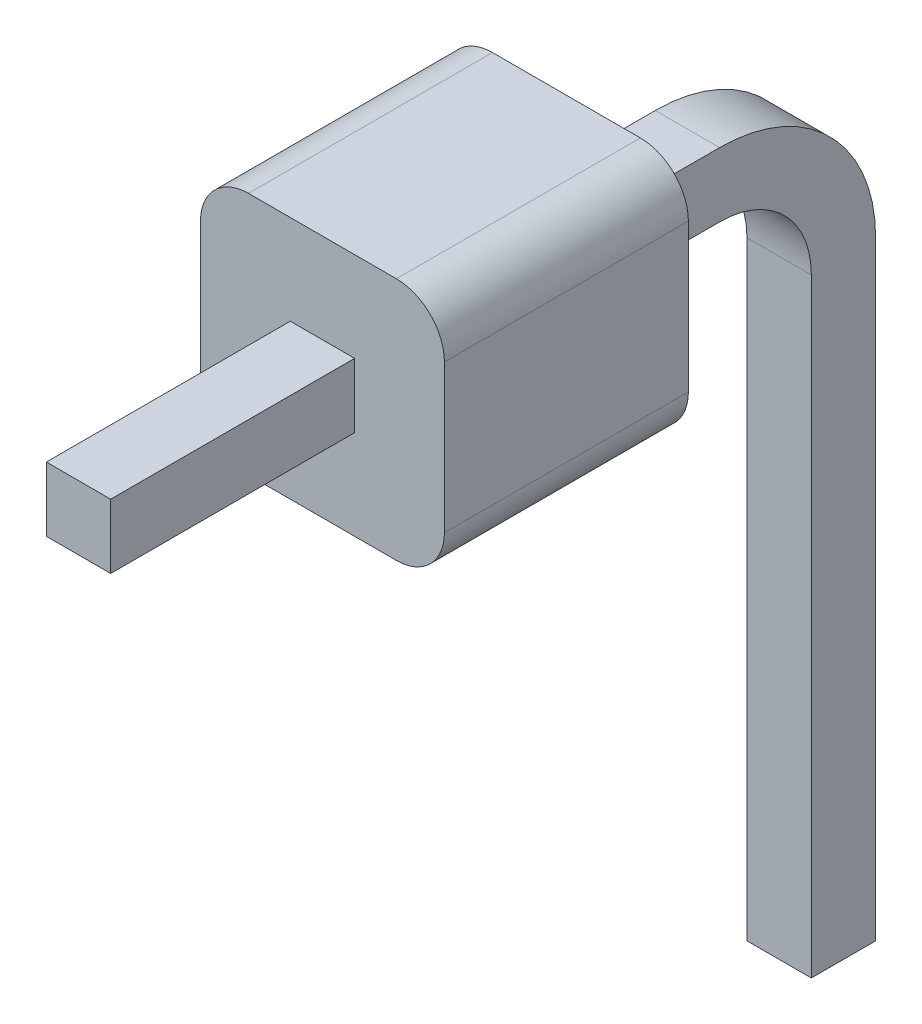
from build123d import *

# Parameters (mm, degrees)
SKETCH_1_W      = 2.54
SKETCH_1_H      = 2.54
EXTRUDE_1_DEPTH = 2.54
SKETCH_2_W      = 0.67
SKETCH_2_H      = 0.67
FILLET_1_R      = 0.5


with BuildPart() as part:
    # 草图1 → 拉伸1 (new body)
    with BuildSketch(Plane.XY):
        with Locations((0, -1.289090726)):
            Rectangle(SKETCH_1_W, SKETCH_1_H)
    extrude(amount=EXTRUDE_1_DEPTH)

    # 扫描1: sweep along a path in 草图3
    with BuildLine(Plane(origin=(0, 0, 0), x_dir=(0, 0, -1), z_dir=(1, 0, 0))) as sweep_1_path:
        Line((-5.08, -1.299090726), (1.26, -1.299090726))
        ThreePointArc((1.26, -1.299090726), (2.16509668, -1.673994046), (2.54, -2.579090726))
        Line((2.54, -2.579090726), (2.54, -8.919090726))
    # 草图2 → 扫描1 (sweep)
    with BuildSketch(Plane(origin=(0, 0, 5.08), x_dir=(-1, 0, 0), z_dir=(0, 0, -1))):
        with Locations((0, -1.289090726)):
            Rectangle(SKETCH_2_W, SKETCH_2_H)
    sweep(path=sweep_1_path.line)

    # 圆角1
    fillet_1_edges = [part.edges().sort_by_distance(p)[0] for p in [
        (1.27, -0.019090726, 1.27),
        (1.27, -2.559090726, 1.27),
        (-1.27, -2.559090726, 1.27),
        (-1.27, -0.019090726, 1.27),
    ]]
    fillet(fillet_1_edges, radius=FILLET_1_R)


solid = part.part
